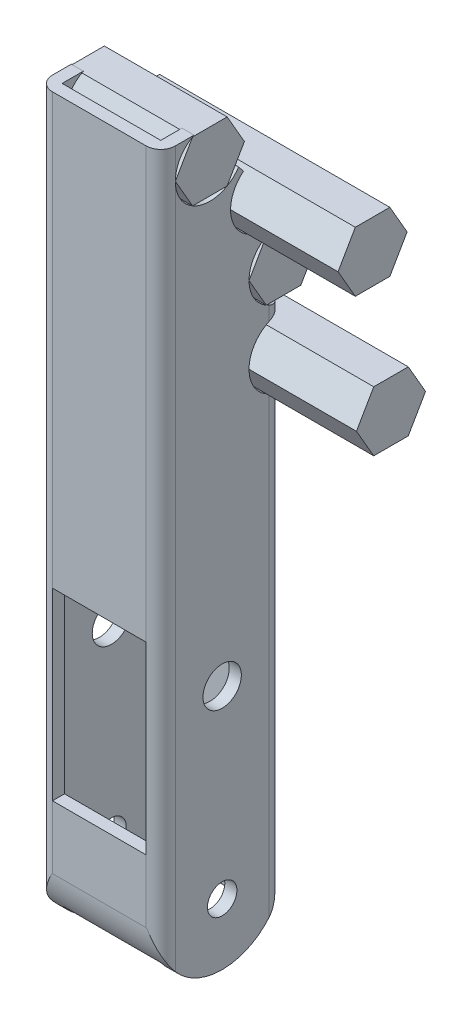
from build123d import *

# Parameters (mm, degrees)
SKETCH1_W             = 25.4
SKETCH1_H             = 25.4
SKETCH1_W_2           = 20.4
SKETCH1_H_2           = 20.4
BOSS_EXTRUDE1_DEPTH   = 152.4
SKETCH2_R             = 3.048
CUT_EXTRUDE1_DEPTH    = 203.2
FILLET1_R             = 3
SKETCH15_R            = 3.97
CUT_EXTRUDE9_DEPTH    = 157.576115805
CUT_EXTRUDE10_DEPTH   = 10
CUT_EXTRUDE11_START   = -25.4
CUT_EXTRUDE11_DEPTH   = 25.4
BOSS_EXTRUDE2_DEPTH   = 25.4
BOSS_EXTRUDE2_2_DEPTH = 25.4
BOSS_EXTRUDE2_3_DEPTH = 25.4
BOSS_EXTRUDE2_4_DEPTH = 25.4
BOSS_EXTRUDE3_DEPTH   = 22.225


# Read off the part's stored shape, not the designer's step: Cut-Extrude11
with BuildPart() as part:
    # Sketch1 → Boss-Extrude1 (new body)
    with BuildSketch(Plane(origin=(0, 0, 0), x_dir=(1, 0, 0), z_dir=(0, 1, 0))):
        with Locations((12.7, 12.7)):
            Rectangle(SKETCH1_W, SKETCH1_H)
        with Locations((12.7, 12.7)):
            Rectangle(SKETCH1_W_2, SKETCH1_H_2, mode=Mode.SUBTRACT)
    extrude(amount=BOSS_EXTRUDE1_DEPTH)

    # Sketch2 → Cut-Extrude1 (cut)
    with BuildSketch(Plane.ZY):
        with Locations((-12.7, 12.7)):
            Circle(SKETCH2_R)
        with BuildLine():
            Line((-25.4, 13.042161995), (-33.088640308, 13.042161995))
            Line((-33.088640308, 13.042161995), (-33.088640308, -7.68562413))
            Line((-33.088640308, -7.68562413), (17.838569311, -8.829541687))
            Line((17.838569311, -8.829541687), (0.004608409, 12.7))
            ThreePointArc((0.004608409, 12.7), (-12.871096514, -0.003456255), (-25.4, 13.042161995))
        make_face()
    extrude(amount=-CUT_EXTRUDE1_DEPTH, mode=Mode.SUBTRACT)

    # Fillet1
    # the kernel refuses this fillet: 3 mm, written as the material it takes off along each edge
    with BuildSketch(Plane(origin=(0, 170.4, -25.4), x_dir=(0, 0, 1), z_dir=(0, -1, 0)), Plane(origin=(25.4, -5.642161995, 0), x_dir=(-1, 0, 0), z_dir=(0, 1, 0))) as fillet1_piece_1:
        with BuildLine():
            CenterArc((FILLET1_R, -FILLET1_R), FILLET1_R, 90, 90)
            Line((0, -FILLET1_R), (-FILLET1_R * 0.02, -FILLET1_R))
            Line((-FILLET1_R * 0.02, -FILLET1_R), (-FILLET1_R * 0.02, FILLET1_R * 0.02))
            Line((-FILLET1_R * 0.02, FILLET1_R * 0.02), (FILLET1_R, FILLET1_R * 0.02))
            Line((FILLET1_R, FILLET1_R * 0.02), (FILLET1_R, 0))
        make_face()
    extrude(amount=176.042161995, mode=Mode.SUBTRACT)
    with BuildSketch(Plane(origin=(25.4, -5.642161995, -25.4), x_dir=(-1, 0, 0), z_dir=(0, 1, 0)), Plane(origin=(0, -5.642161995, 0), x_dir=(1, 0, 0), z_dir=(0, 1, 0))) as fillet1_piece_2:
        with BuildLine():
            CenterArc((FILLET1_R, FILLET1_R), FILLET1_R, 180, 90)
            Line((0, FILLET1_R), (-FILLET1_R * 0.02, FILLET1_R))
            Line((-FILLET1_R * 0.02, FILLET1_R), (-FILLET1_R * 0.02, -FILLET1_R * 0.02))
            Line((-FILLET1_R * 0.02, -FILLET1_R * 0.02), (FILLET1_R, -FILLET1_R * 0.02))
            Line((FILLET1_R, -FILLET1_R * 0.02), (FILLET1_R, 0))
        make_face()
    extrude(amount=176.042161995, mode=Mode.SUBTRACT)

    # Sketch15 → Cut-Extrude9 (cut, through all)
    with BuildSketch(Plane.ZY):
        with Locations((-12.7, 50.8)):
            Circle(SKETCH15_R)
    extrude(amount=-CUT_EXTRUDE9_DEPTH, mode=Mode.SUBTRACT)

    # Sketch16 → Cut-Extrude10 (cut)
    with BuildSketch(Plane.XY):
        Polygon((3, 63.5), (22.4, 63.5), (22.4, 38.1), (22.4, 25.4), (3, 25.4), (3, 38.1), align=None)
    extrude(amount=-CUT_EXTRUDE10_DEPTH, mode=Mode.SUBTRACT)

    # Cut-Extrude11 outline → Cut-Extrude11 (cut)
    with BuildSketch(Plane.ZY.offset(CUT_EXTRUDE11_START)):
        with BuildLine():
            Line((-17.115600123, 140.823923576), (-16.102381509, 142.084994822))
            ThreePointArc((-16.102381509, 142.084994822), (-4.832560404, 141.290635399), (-6.88728491, 152.4))
            Line((-6.88728491, 152.4), (-25.4, 152.4))
            Line((-25.4, 152.4), (-25.400002306, 113.50625))
            ThreePointArc((-25.400002306, 113.50625), (-18.280723067, 120.059186987), (-24.222424264, 127.696025791))
            Line((-24.222424264, 127.696025791), (-24.078264617, 128.558605204))
            ThreePointArc((-24.078264617, 128.558605204), (-15.377456881, 131.728319967), (-17.115600123, 140.823923576))
        make_face()
        with BuildLine():
            Line((-25.400002306, 111.91875), (-25.400002306, 97.63125))
            ThreePointArc((-25.400002306, 97.63125), (-18.25625, 104.775), (-25.400002306, 111.91875))
        make_face()
    extrude(amount=CUT_EXTRUDE11_DEPTH, mode=Mode.SUBTRACT)


with BuildPart() as body_2:
    # Sketch21 → Boss-Extrude2 (new body)
    with BuildSketch(Plane.ZY):
        Polygon((-28.971875, 110.961668978), (-32.54375, 104.775), (-28.971875, 98.588331022), (-21.828125, 98.588331022), (-18.25625, 104.775), (-21.828125, 110.961668978), align=None)
    extrude(amount=-BOSS_EXTRUDE2_DEPTH)



with BuildPart() as body_3:
    # Sketch21 → Boss-Extrude2 2 (new body)
    with BuildSketch(Plane.ZY):
        Polygon((-18.25625, 120.65), (-21.828125, 126.836668978), (-28.971875, 126.836668978), (-32.54375, 120.65), (-28.971875, 114.463331022), (-21.828125, 114.463331022), align=None)
    extrude(amount=-BOSS_EXTRUDE2_2_DEPTH)


with BuildPart() as body_4:
    # Sketch21 → Boss-Extrude2 3 (new body)
    with BuildSketch(Plane.ZY):
        Polygon((-18.018125, 141.441668978), (-25.161875, 141.441668978), (-28.73375, 135.255), (-25.161875, 129.068331022), (-18.018125, 129.068331022), (-14.44625, 135.255), align=None)
    extrude(amount=-BOSS_EXTRUDE2_3_DEPTH)


with BuildPart() as body_5:
    # Sketch21 → Boss-Extrude2 4 (new body)
    with BuildSketch(Plane.ZY):
        Polygon((-3.01625, 146.05), (-6.588125, 152.236668978), (-13.731875, 152.236668978), (-17.30375, 146.05), (-13.731875, 139.863331022), (-6.588125, 139.863331022), align=None)
    extrude(amount=-BOSS_EXTRUDE2_4_DEPTH)


with BuildPart() as body_2_1:
    add(body_2.part)

    add(body_4.part)  # Boss-Extrude3 merges body 4
    # Sketch22 → Boss-Extrude3 (add)
    with BuildSketch(Plane(origin=(25.4, 0, 0), x_dir=(0, 0, -1), z_dir=(1, 0, 0))):
        Polygon((18.018125, 141.441668978), (14.44625, 135.255), (18.018125, 129.068331022), (25.161875, 129.068331022), (28.73375, 135.255), (25.161875, 141.441668978), align=None)
        Polygon((28.971875, 110.961668978), (21.828125, 110.961668978), (18.25625, 104.775), (21.828125, 98.588331022), (28.971875, 98.588331022), (32.54375, 104.775), align=None)
    extrude(amount=BOSS_EXTRUDE3_DEPTH)


solid = Compound([part.part, body_3.part, body_5.part, body_2_1.part])
